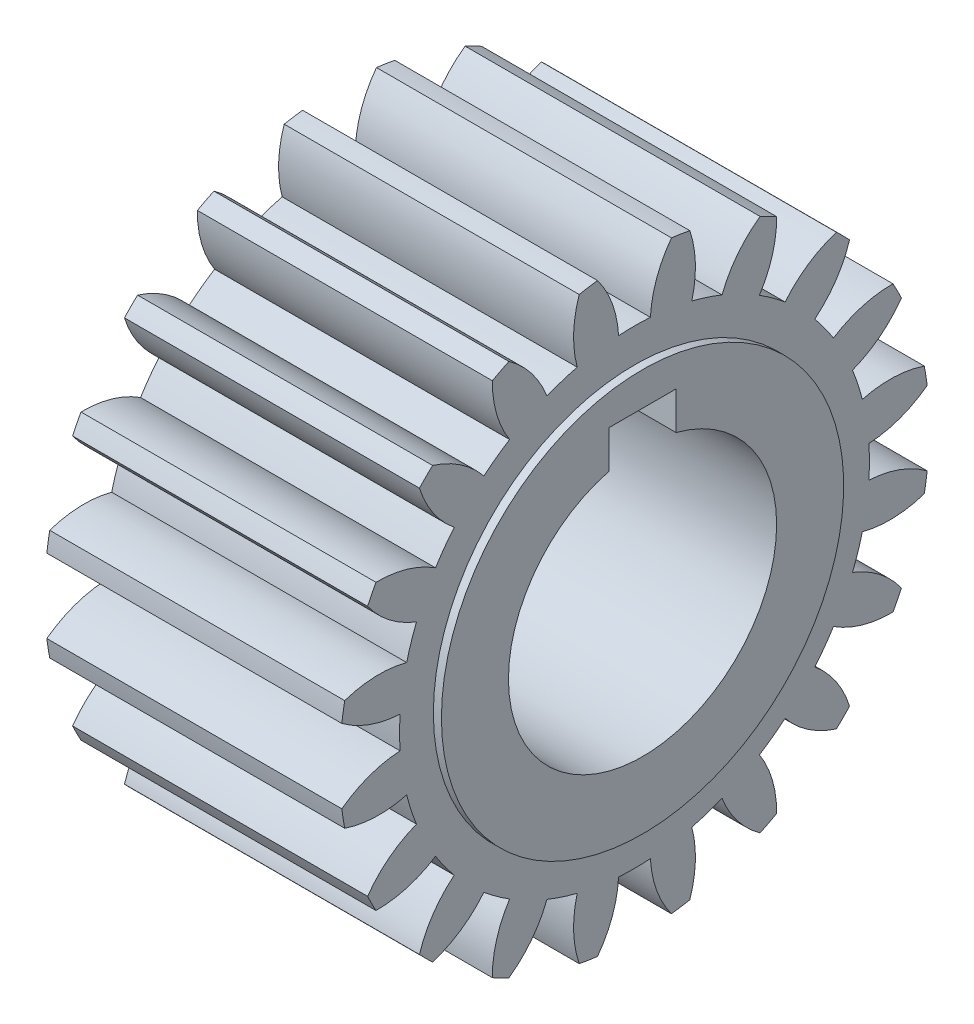
from build123d import *

# Parameters (mm, degrees)
SPUR_START             = -42.145535126
SPUR_GEAR_AI_OUTLINE_R = 6.35
SPUR_GEAR_AI_DEPTH     = 13.97
SKETCH1_W              = 3.175
SKETCH1_H              = 3.175
CUT_EXTRUDE1_DEPTH     = 41.258239372
SKETCH2_R              = 9.525
BOSS_EXTRUDE1_DEPTH    = 0.381
BOSS_EXTRUDE2_START    = 0.381
SKETCH3_R              = 9.525
BOSS_EXTRUDE2_DEPTH    = 0.381


# Read off the part's stored shape, not the designer's step: spur gear_ai
with BuildPart() as part:
    # spur gear_ai outline → spur gear_ai (new body)
    with BuildSketch(Plane.YZ.offset(SPUR_START)):
        with BuildLine():
            ThreePointArc((21.89573329, 8.949900066), (22.10150024, 9.338497576), (22.294935451, 9.733378421))
            ThreePointArc((22.294935451, 9.733378421), (21.269289936, 10.804918767), (19.977842952, 11.534516))
            ThreePointArc((19.977842952, 11.534516), (20.234833052, 12.242868992), (20.443283136, 12.966993591))
            ThreePointArc((20.443283136, 12.966993591), (21.916932187, 12.79815666), (23.376532451, 13.062191702))
            ThreePointArc((23.376532451, 13.062191702), (23.452145215, 13.495355381), (23.514088141, 13.93068415))
            ThreePointArc((23.514088141, 13.93068415), (22.207517114, 14.632837684), (20.7538201, 14.927646821))
            ThreePointArc((20.7538201, 14.927646821), (20.779339097, 15.680744858), (20.7538201, 16.433842895))
            ThreePointArc((20.7538201, 16.433842895), (22.207517114, 16.728652032), (23.514088141, 17.430805566))
            ThreePointArc((23.514088141, 17.430805566), (23.452145215, 17.866134334), (23.376532451, 18.299298013))
            ThreePointArc((23.376532451, 18.299298013), (21.916932187, 18.563333056), (20.443283136, 18.394496125))
            ThreePointArc((20.443283136, 18.394496125), (20.234833052, 19.118620724), (19.977842952, 19.826973715))
            ThreePointArc((19.977842952, 19.826973715), (21.269289936, 20.556570948), (22.294935451, 21.628111294))
            ThreePointArc((22.294935451, 21.628111294), (22.10150024, 22.022992139), (21.89573329, 22.41158965))
            ThreePointArc((21.89573329, 22.41158965), (20.425979632, 22.21166061), (19.07662958, 21.595704547))
            ThreePointArc((19.07662958, 21.595704547), (18.654614962, 22.219973346), (18.191309741, 22.814242767))
            ThreePointArc((18.191309741, 22.814242767), (19.194090867, 23.907210035), (19.83841354, 25.243247358))
            ThreePointArc((19.83841354, 25.243247358), (19.53242083, 25.559026591), (19.216641597, 25.865019301))
            ThreePointArc((19.216641597, 25.865019301), (17.880604274, 25.220696628), (16.787637006, 24.217915502))
            ThreePointArc((16.787637006, 24.217915502), (16.193367585, 24.681220723), (15.569098786, 25.103235341))
            ThreePointArc((15.569098786, 25.103235341), (16.185054849, 26.452585393), (16.384983889, 27.922339051))
            ThreePointArc((16.384983889, 27.922339051), (15.996386378, 28.128106001), (15.601505533, 28.321541212))
            ThreePointArc((15.601505533, 28.321541212), (14.529965187, 27.295895697), (13.800367954, 26.004448713))
            ThreePointArc((13.800367954, 26.004448713), (13.092014963, 26.261438813), (12.367890364, 26.469888897))
            ThreePointArc((12.367890364, 26.469888897), (12.536727295, 27.943537948), (12.272692252, 29.403138212))
            ThreePointArc((12.272692252, 29.403138212), (11.839528573, 29.478750976), (11.404199805, 29.540693902))
            ThreePointArc((11.404199805, 29.540693902), (10.702046271, 28.234122875), (10.407237134, 26.780425861))
            ThreePointArc((10.407237134, 26.780425861), (9.654139097, 26.805944858), (8.90104106, 26.780425861))
            ThreePointArc((8.90104106, 26.780425861), (8.606231923, 28.234122875), (7.904078389, 29.540693902))
            ThreePointArc((7.904078389, 29.540693902), (7.46874962, 29.478750976), (7.035585941, 29.403138212))
            ThreePointArc((7.035585941, 29.403138212), (6.771550899, 27.943537948), (6.94038783, 26.469888897))
            ThreePointArc((6.94038783, 26.469888897), (6.216263231, 26.261438813), (5.507910239, 26.004448713))
            ThreePointArc((5.507910239, 26.004448713), (4.778313006, 27.295895697), (3.70677266, 28.321541212))
            ThreePointArc((3.70677266, 28.321541212), (3.311891815, 28.128106001), (2.923294305, 27.922339051))
            ThreePointArc((2.923294305, 27.922339051), (3.123223344, 26.452585393), (3.739179408, 25.103235341))
            ThreePointArc((3.739179408, 25.103235341), (3.114910608, 24.681220723), (2.520641187, 24.217915502))
            ThreePointArc((2.520641187, 24.217915502), (1.427673919, 25.220696628), (0.091636597, 25.865019301))
            ThreePointArc((0.091636597, 25.865019301), (-0.224142637, 25.559026591), (-0.530135347, 25.243247358))
            ThreePointArc((-0.530135347, 25.243247358), (0.114187326, 23.907210035), (1.116968452, 22.814242767))
            ThreePointArc((1.116968452, 22.814242767), (0.653663231, 22.219973346), (0.231648613, 21.595704547))
            ThreePointArc((0.231648613, 21.595704547), (-1.117701439, 22.21166061), (-2.587455096, 22.41158965))
            ThreePointArc((-2.587455096, 22.41158965), (-2.793222046, 22.022992139), (-2.986657258, 21.628111294))
            ThreePointArc((-2.986657258, 21.628111294), (-1.961011743, 20.556570948), (-0.669564759, 19.826973715))
            ThreePointArc((-0.669564759, 19.826973715), (-0.926554858, 19.118620723), (-1.135004943, 18.394496125))
            ThreePointArc((-1.135004943, 18.394496125), (-2.608653994, 18.563333056), (-4.068254258, 18.299298013))
            ThreePointArc((-4.068254258, 18.299298013), (-4.143867021, 17.866134334), (-4.205809948, 17.430805566))
            ThreePointArc((-4.205809948, 17.430805566), (-2.899238921, 16.728652032), (-1.445541907, 16.433842895))
            ThreePointArc((-1.445541907, 16.433842895), (-1.471060903, 15.680744858), (-1.445541907, 14.927646821))
            ThreePointArc((-1.445541907, 14.927646821), (-2.899238921, 14.632837684), (-4.205809948, 13.93068415))
            ThreePointArc((-4.205809948, 13.93068415), (-4.143867021, 13.495355381), (-4.068254258, 13.062191702))
            ThreePointArc((-4.068254258, 13.062191702), (-2.608653994, 12.79815666), (-1.135004943, 12.966993591))
            ThreePointArc((-1.135004943, 12.966993591), (-0.926554858, 12.242868992), (-0.669564759, 11.534516))
            ThreePointArc((-0.669564759, 11.534516), (-1.961011743, 10.804918767), (-2.986657258, 9.733378421))
            ThreePointArc((-2.986657258, 9.733378421), (-2.793222046, 9.338497576), (-2.587455096, 8.949900066))
            ThreePointArc((-2.587455096, 8.949900066), (-1.117701439, 9.149829105), (0.231648613, 9.765785169))
            ThreePointArc((0.231648613, 9.765785169), (0.653663231, 9.141516369), (1.116968452, 8.547246948))
            ThreePointArc((1.116968452, 8.547246948), (0.114187326, 7.45427968), (-0.530135347, 6.118242358))
            ThreePointArc((-0.530135347, 6.118242358), (-0.224142637, 5.802463124), (0.091636597, 5.496470414))
            ThreePointArc((0.091636597, 5.496470414), (1.427673919, 6.140793087), (2.520641187, 7.143574213))
            ThreePointArc((2.520641187, 7.143574213), (3.114910608, 6.680268992), (3.739179408, 6.258254374))
            ThreePointArc((3.739179408, 6.258254374), (3.123223344, 4.908904322), (2.923294305, 3.439150665))
            ThreePointArc((2.923294305, 3.439150665), (3.311891815, 3.233383715), (3.70677266, 3.039948503))
            ThreePointArc((3.70677266, 3.039948503), (4.778313006, 4.065594018), (5.507910239, 5.357041002))
            ThreePointArc((5.507910239, 5.357041002), (6.216263231, 5.100050903), (6.94038783, 4.891600818))
            ThreePointArc((6.94038783, 4.891600818), (6.771550899, 3.417951767), (7.035585941, 1.958351503))
            ThreePointArc((7.035585941, 1.958351503), (7.46874962, 1.882738739), (7.904078389, 1.820795813))
            ThreePointArc((7.904078389, 1.820795813), (8.606231923, 3.12736684), (8.90104106, 4.581063854))
            ThreePointArc((8.90104106, 4.581063854), (9.654139097, 4.555544858), (10.407237134, 4.581063854))
            ThreePointArc((10.407237134, 4.581063854), (10.702046271, 3.12736684), (11.404199805, 1.820795813))
            ThreePointArc((11.404199805, 1.820795813), (11.839528573, 1.882738739), (12.272692252, 1.958351503))
            ThreePointArc((12.272692252, 1.958351503), (12.536727295, 3.417951767), (12.367890364, 4.891600818))
            ThreePointArc((12.367890364, 4.891600818), (13.092014962, 5.100050903), (13.800367954, 5.357041002))
            ThreePointArc((13.800367954, 5.357041002), (14.529965187, 4.065594018), (15.601505533, 3.039948503))
            ThreePointArc((15.601505533, 3.039948503), (15.996386378, 3.233383715), (16.384983889, 3.439150665))
            ThreePointArc((16.384983889, 3.439150665), (16.185054849, 4.908904322), (15.569098786, 6.258254374))
            ThreePointArc((15.569098786, 6.258254374), (16.193367585, 6.680268992), (16.787637006, 7.143574213))
            ThreePointArc((16.787637006, 7.143574213), (17.880604274, 6.140793087), (19.216641597, 5.496470414))
            ThreePointArc((19.216641597, 5.496470414), (19.53242083, 5.802463124), (19.83841354, 6.118242358))
            ThreePointArc((19.83841354, 6.118242358), (19.194090867, 7.45427968), (18.191309741, 8.547246948))
            ThreePointArc((18.191309741, 8.547246948), (18.654614962, 9.141516369), (19.07662958, 9.765785169))
            ThreePointArc((19.07662958, 9.765785169), (20.425979632, 9.149829105), (21.89573329, 8.949900066))
        make_face()
        with Locations((9.654139097, 15.680744858)):
            Circle(SPUR_GEAR_AI_OUTLINE_R, mode=Mode.SUBTRACT)
    extrude(amount=SPUR_GEAR_AI_DEPTH)

    # Sketch1 → Cut-Extrude1 (cut, through all)
    with BuildSketch(Plane(origin=(-28.175535126, 0, 0), x_dir=(0, 0, -1), z_dir=(1, 0, 0))):
        with Locations((-15.680744858, 16.004139097)):
            Rectangle(SKETCH1_W, SKETCH1_H)
    extrude(amount=-CUT_EXTRUDE1_DEPTH, mode=Mode.SUBTRACT)

    # Sketch2 → Boss-Extrude1 (add)
    with BuildSketch(Plane(origin=(-28.175535126, 0, 0), x_dir=(0, 0, -1), z_dir=(1, 0, 0))):
        with Locations(Location((-15.680744858, 9.654139097, 0), (0, 0, 180))):
            Circle(SKETCH2_R)
        with BuildLine():
            Line((-14.093244858, 17.591639097), (-17.268244858, 17.591639097))
            Line((-17.268244858, 17.591639097), (-17.268244858, 15.802500159))
            ThreePointArc((-17.268244858, 15.802500159), (-15.680744858, 3.304139097), (-14.093244858, 15.802500159))
            Line((-14.093244858, 15.802500159), (-14.093244858, 17.591639097))
        make_face(mode=Mode.SUBTRACT)
    extrude(amount=BOSS_EXTRUDE1_DEPTH)

    # Sketch3 → Boss-Extrude2 (add)
    with BuildSketch(Plane.ZY.offset(42.145535126).offset(BOSS_EXTRUDE2_START)):
        with Locations((15.680744858, 9.654139097)):
            Circle(SKETCH3_R)
        with BuildLine():
            Line((14.093244858, 15.802500159), (14.093244858, 17.591639097))
            Line((14.093244858, 17.591639097), (17.268244858, 17.591639097))
            Line((17.268244858, 17.591639097), (17.268244858, 15.802500159))
            ThreePointArc((17.268244858, 15.802500159), (15.680744858, 3.304139097), (14.093244858, 15.802500159))
        make_face(mode=Mode.SUBTRACT)
    extrude(amount=-BOSS_EXTRUDE2_DEPTH)


solid = part.part
